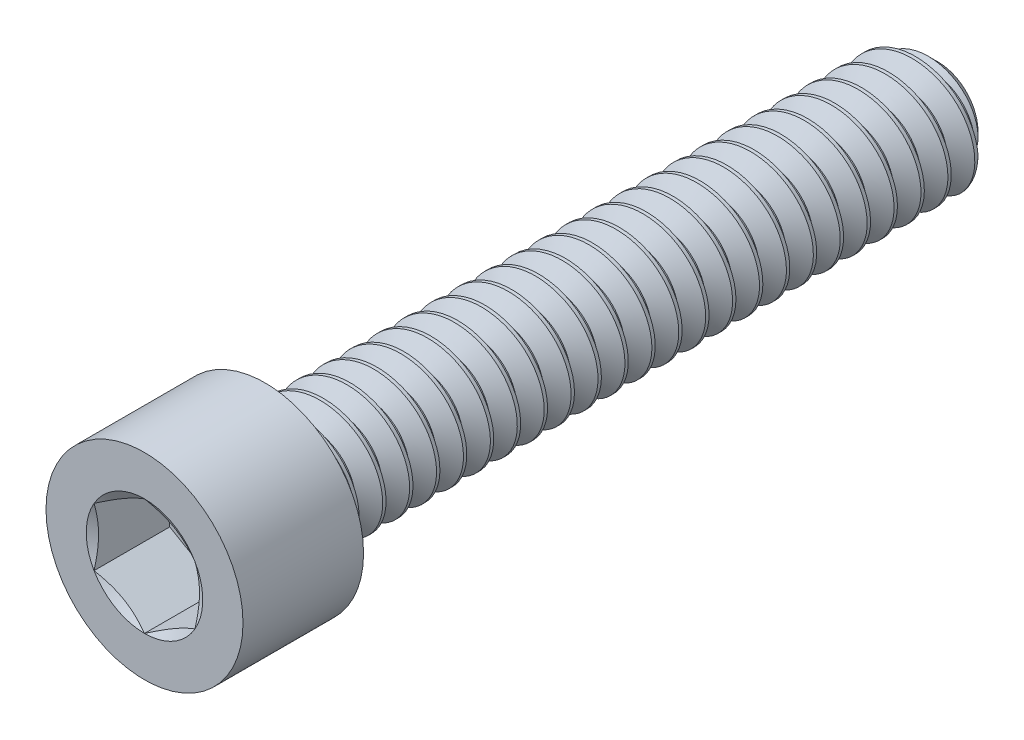
from build123d import *

# Parameters (mm, degrees)
CUT_EXTRUDE1_DEPTH        = 1.7859375
CUT_SWEEP1_PITCH          = 0.635
CUT_SWEEP1_TO             = 15.795625
BOSS_EXTRUDE5_START       = -1
BOSS_EXTRUDE5_OUTLINE_R   = 1.4859
BOSS_EXTRUDE5_OUTLINE_R_2 = 1.4224
BOSS_EXTRUDE5_DEPTH       = 1


with BuildPart() as part:
    # Sketch2 → Revolve1 (revolve)
    with BuildSketch(Plane(origin=(0, 0, 0), x_dir=(0, 0, -1), z_dir=(1, 0, 0)), mode=Mode.PRIVATE) as revolve1_sk:
        Polygon((9.3599, 0.94615), (8.88365, 1.4224), (-6.5151, 1.4224), (-6.5151, 2.3241), (-9.3599, 2.3241), (-9.3599, 0), (9.3599, 0), align=None)
    revolve(revolve1_sk.sketch.rotate(Axis((0, 0, -9.3599), (0, 0, 1)), 90), axis=Axis((0, 0, -9.3599), (0, 0, 1)))

    # Sketch4 → Cut-Extrude1 (cut)
    with BuildSketch(Plane.XY.offset(9.3599)):
        Polygon((0, 1.374815329), (-1.190625, 0.687407664), (-1.190625, -0.687407664), (0, -1.374815329), (1.190625, -0.687407664), (1.190625, 0.687407664), align=None)
    extrude(amount=-CUT_EXTRUDE1_DEPTH, mode=Mode.SUBTRACT)

    # Cut-Extrude2 cone 1 section (through the dimple's axis) → Cut-Extrude2 (revolve, cut)
    with BuildSketch(Plane(origin=(0, 0, 9.3599), x_dir=(0, -1, 0), z_dir=(1, 0, 0))):
        Polygon((0, 0), (1.374815329, 0), (0, 0.79375), align=None)
    revolve(axis=Axis((0, 0, 9.3599), (0, 0, -1)), mode=Mode.SUBTRACT)


with BuildPart() as body_2:
    # Split1: the piece on the far side of the plane
    add(part.part)
    split(bisect_by=Plane(origin=(0, 0, 6.435725), x_dir=(-1, 0, 0), z_dir=(0, 0, -1)), keep=Keep.BOTTOM)

    # Boss-Extrude5: read off the stored shape, not the designer's step
    # Boss-Extrude5 outline → Boss-Extrude5 (add)
    with BuildSketch(Plane(origin=(0, 0, 6.435725), x_dir=(-1, 0, 0), z_dir=(0, 0, -1)).offset(BOSS_EXTRUDE5_START)):
        Circle(BOSS_EXTRUDE5_OUTLINE_R)
        Circle(BOSS_EXTRUDE5_OUTLINE_R_2, mode=Mode.SUBTRACT)
    extrude(amount=BOSS_EXTRUDE5_DEPTH)


with BuildPart() as part_1:
    add(part.part)

    # Split1
    split(bisect_by=Plane(origin=(0, 0, 6.435725), x_dir=(-1, 0, 0), z_dir=(0, 0, -1)), keep=Keep.TOP)

    # Cut-Sweep1: arcs per turn and ends read off the stored shape
    # Cut-Sweep1: the profile of Sketch7 profile screwed along a right-hand helix through 26 turns, 6 arcs to a turn; built about Z, then put on its axis
    cut_sweep1_z = Axis((0, 0, 0), (0, 0, 1))
    cut_sweep1_corners = [(1.4227, 0, 0.000173205), (1.4227, 0, -0.555798205), (1.009955401, 0, -0.3175), (1.009955401, 0, -0.238125)]
    with BuildLine(mode=Mode.PRIVATE) as cut_sweep1_profile:
        Line(cut_sweep1_corners[0], cut_sweep1_corners[1])
        Line(cut_sweep1_corners[1], cut_sweep1_corners[2])
        Line(cut_sweep1_corners[2], cut_sweep1_corners[3])
        Line(cut_sweep1_corners[3], cut_sweep1_corners[0])
    cut_sweep1_cap = Face(cut_sweep1_profile.wire())
    cut_sweep1_turn_angles = [0, 30, 60, 90, 120, 150, 180, 210, 240, 270, 300, 330, 360]
    cut_sweep1_turn_weights = [1, 0.8660254037844387, 1, 0.8660254037844387, 1, 0.8660254037844387, 1, 0.8660254037844387, 1, 0.8660254037844387, 1, 0.8660254037844387, 1]
    cut_sweep1_turn_rails = [Edge.make_bspline([Vector(p[0], p[1], 0).rotate(cut_sweep1_z, cut_sweep1_turn_angles[k]) / cut_sweep1_turn_weights[k] + Vector(0, 0, p[2] + CUT_SWEEP1_PITCH * cut_sweep1_turn_angles[k] / 360) for k in range(13)], [0, 0, 0, 1, 1, 2, 2, 3, 3, 4, 4, 5, 5, 6, 6, 6], 2, cut_sweep1_turn_weights) for p in cut_sweep1_corners]
    cut_sweep1_turn_sides = [Face.make_surface_from_curves(cut_sweep1_turn_rails[p[0]], cut_sweep1_turn_rails[p[1]]) for p in [(0, 1), (1, 2), (2, 3), (3, 0)]]
    cut_sweep1 = Plane(origin=(0, 0, -9.3599), x_dir=(0, 1, 0), z_dir=(0, 0, 1)) * split(Solid(Shell([*[p.moved(Location((0, 0, CUT_SWEEP1_PITCH * i))) for i in range(26) for p in cut_sweep1_turn_sides], cut_sweep1_cap, cut_sweep1_cap.rotate(cut_sweep1_z, 9360).moved(Location((0, 0, CUT_SWEEP1_PITCH * 9360 / 360)))])), bisect_by=Plane.XY.offset(CUT_SWEEP1_TO), keep=Keep.BOTTOM, mode=Mode.PRIVATE)
    add(cut_sweep1, mode=Mode.SUBTRACT)

    add(body_2.part)  # Boss-Extrude4 merges body 2
    # Boss-Extrude4: read off the stored shape, not the designer's step
    # Boss-Extrude4 outline → Boss-Extrude4 (revolve)
    with BuildSketch(Plane.XZ):
        Polygon((1.009950696, 6.435725), (1.009950696, 6.162676514), (1.4859, 6.435725), align=None)
    revolve(axis=Axis((0, 0, 0), (0, 0, 1)))


solid = part_1.part
